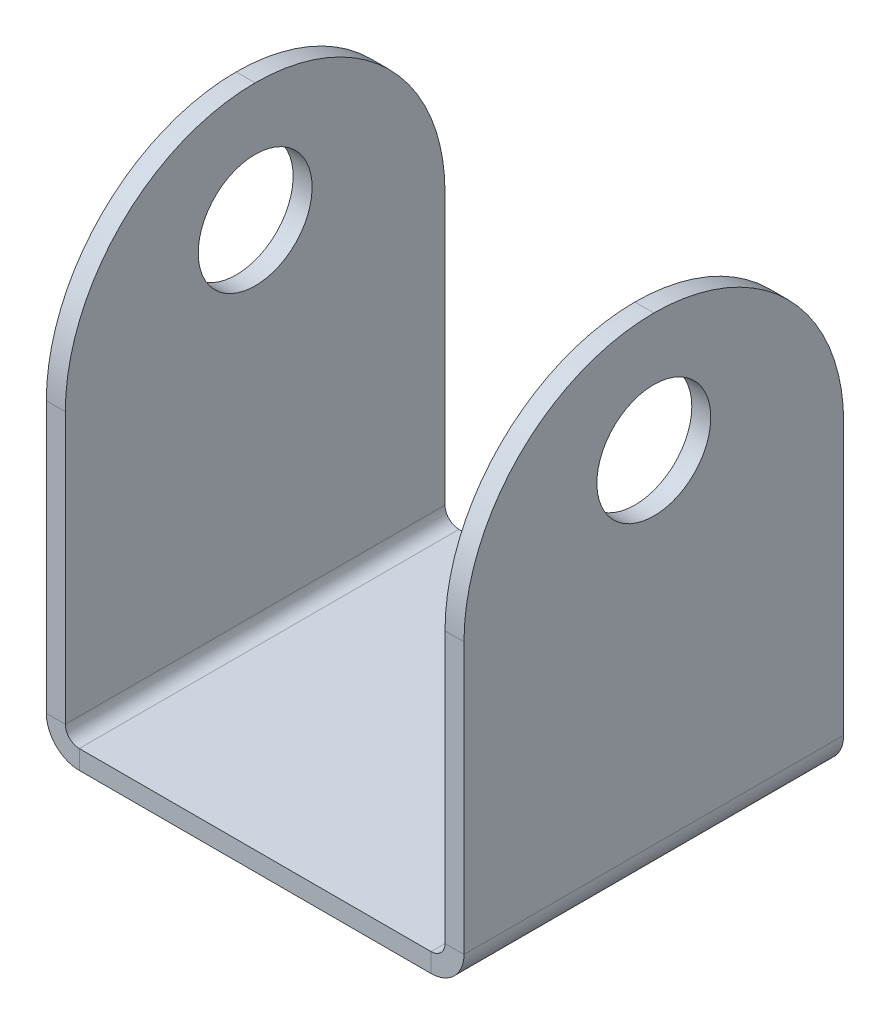
from build123d import *

# Parameters (mm, degrees)
CROQUIS1_W                         = 20
CROQUIS1_H                         = 20
BRIDA_BASE1_DEPTH                  = 1
BRIDA_DE_ARISTA1_STRIP_W           = 5.4732
BRIDA_DE_ARISTA1_STRIP_H           = 1
BRIDA_DE_ARISTA1_STRIP_CUT_DEPTH   = 20
BRIDA_DE_ARISTA1_STRIP_2_W         = 5.4732
BRIDA_DE_ARISTA1_STRIP_2_H         = 1
BRIDA_DE_ARISTA1_STRIP_CUT_2_DEPTH = 20
BRIDA_DE_ARISTA1_DEPTH             = 20
BRIDA_DE_ARISTA1_BEND_DEPTH        = 20
CROQUIS12_R                        = 3
CORTAR_EXTRUIR1_DEPTH              = 35.770677301
REDONDEO1_R                        = 10


# Sheet-metal steps are written as plain solids
with BuildPart() as part:
    # Croquis1 → Brida base1 (new body)
    with BuildSketch(Plane(origin=(0, 0, 0), x_dir=(1, 0, 0), z_dir=(0, 1, 0))):
        Rectangle(CROQUIS1_W, CROQUIS1_H)
    extrude(amount=-BRIDA_BASE1_DEPTH)

    # Brida de arista1 strip (across the edge) → Brida de arista1 strip cut (cut)
    with BuildSketch(Plane(origin=(10, 0, 10), x_dir=(-1, 0, 0), z_dir=(0, 0, -1))):
        with Locations((-2, -0.5)):
            Rectangle(BRIDA_DE_ARISTA1_STRIP_W, BRIDA_DE_ARISTA1_STRIP_H)
    extrude(amount=BRIDA_DE_ARISTA1_STRIP_CUT_DEPTH, mode=Mode.SUBTRACT)

    # Brida de arista1 strip 2 (across the edge) → Brida de arista1 strip cut 2 (cut)
    with BuildSketch(Plane(origin=(-10, 0, -10), x_dir=(1, 0, 0), z_dir=(0, 0, 1))):
        with Locations((-2, -0.5)):
            Rectangle(BRIDA_DE_ARISTA1_STRIP_2_W, BRIDA_DE_ARISTA1_STRIP_2_H)
    extrude(amount=BRIDA_DE_ARISTA1_STRIP_CUT_2_DEPTH, mode=Mode.SUBTRACT)

    # Brida de arista1 section (across the edge) → Brida de arista1 (add)
    with BuildSketch(Plane(origin=(10, 0, 10), x_dir=(-1, 0, 0), z_dir=(0, 0, -1))):
        with BuildLine():
            Line((-1, 0.7366), (-1, 25))
            Line((-1, 25), (0, 25))
            Line((0, 25), (0, 0.7366))
            ThreePointArc((0, 0.7366), (0.215745145, 0.215745145), (0.7366, 0))
            Line((0.7366, 0), (0.7366, -1))
            ThreePointArc((0.7366, -1), (-0.491361636, -0.491361636), (-1, 0.7366))
        make_face()
    extrude(amount=BRIDA_DE_ARISTA1_DEPTH)

    # Brida de arista1 section 2 (across the edge) → Brida de arista1 bend (add)
    with BuildSketch(Plane(origin=(-10, 0, -10), x_dir=(1, 0, 0), z_dir=(0, 0, 1))):
        with BuildLine():
            Line((-1, 0.7366), (-1, 25))
            Line((-1, 25), (0, 25))
            Line((0, 25), (0, 0.7366))
            ThreePointArc((0, 0.7366), (0.215745145, 0.215745145), (0.7366, 0))
            Line((0.7366, 0), (0.7366, -1))
            ThreePointArc((0.7366, -1), (-0.491361636, -0.491361636), (-1, 0.7366))
        make_face()
    extrude(amount=BRIDA_DE_ARISTA1_BEND_DEPTH)

    # Croquis12 → Cortar-Extruir1 (cut, through all)
    with BuildSketch(Plane(origin=(11, 0, 0), x_dir=(0, 0, -1), z_dir=(1, 0, 0))):
        with Locations(Location((0, 18.7366, 0), (0, 0, 90))):
            Circle(CROQUIS12_R)
    extrude(amount=-CORTAR_EXTRUIR1_DEPTH, mode=Mode.SUBTRACT)

    # Redondeo1
    redondeo1_edges = [part.edges().sort_by_distance(p)[0] for p in [
        (-10.5, 25, -10),
        (10.5, 25, -10),
        (10.5, 25, 10),
        (-10.5, 25, 10),
    ]]
    fillet(redondeo1_edges, radius=REDONDEO1_R - 0.0001)  # a hair under: the kernel refuses the full size


solid = part.part
